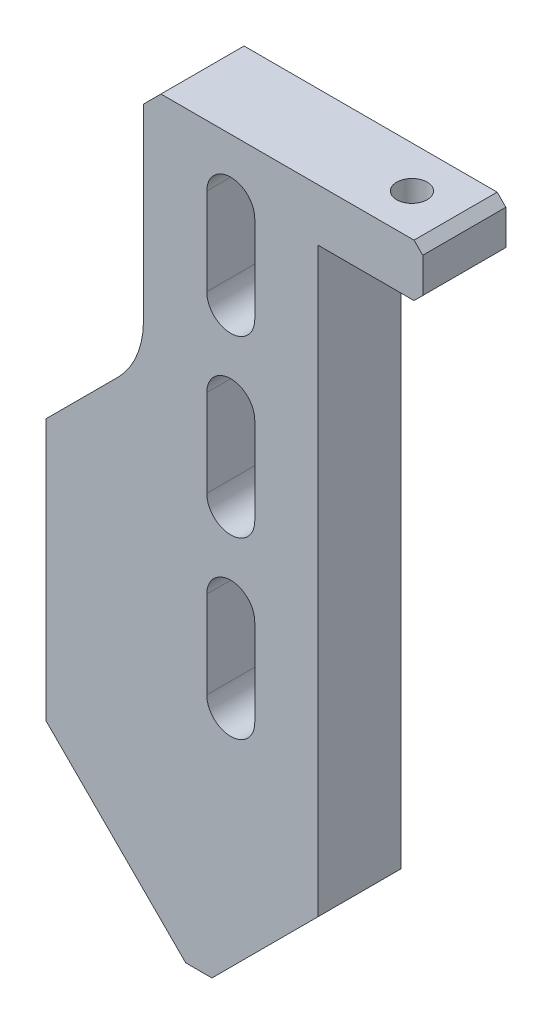
from build123d import *

# Parameters (mm, degrees)
BOSS_EXTRUDE1_DEPTH      = 4.7625
BOSS_EXTRUDE1_DEPTH_BACK = 4.7625
SKETCH2_R                = 1.75
CUT_EXTRUDE1_DEPTH       = 225.119197409
FILLET1_R                = 10
CHAMFER1_SIZE            = 2
CHAMFER2_SIZE            = 1


with BuildPart() as part:
    # Sketch1 → Boss-Extrude1 (new, two sides: drawn at the far end of the back side and taken through both)
    with BuildSketch(Plane.XY.offset(-BOSS_EXTRUDE1_DEPTH_BACK)):
        Polygon((-191.403805922, 11.396194078), (-207.403805922, 27.396194078), (-207.403805922, 57.396194078), (-196.247691321, 68.552308679), (-196.247691321, 96.192388155), (-164.247691321, 96.192388155), (-164.247691321, 90.192388155), (-176.247691321, 90.192388155), (-176.247691321, 23.552308679), (-188.403805922, 11.396194078), align=None)
        with BuildLine():
            Line((-183.497691321, 39.192388155), (-183.497691321, 49.192388155))
            ThreePointArc((-183.497691321, 49.192388155), (-186.247691321, 51.942388155), (-188.997691321, 49.192388155))
            Line((-188.997691321, 49.192388155), (-188.997691321, 39.192388155))
            ThreePointArc((-188.997691321, 39.192388155), (-186.247691321, 36.442388155), (-183.497691321, 39.192388155))
        make_face(mode=Mode.SUBTRACT)
        with BuildLine():
            Line((-183.497691321, 59.192388155), (-183.497691321, 69.192388155))
            ThreePointArc((-183.497691321, 69.192388155), (-186.247691321, 71.942388155), (-188.997691321, 69.192388155))
            Line((-188.997691321, 69.192388155), (-188.997691321, 59.192388155))
            ThreePointArc((-188.997691321, 59.192388155), (-186.247691321, 56.442388155), (-183.497691321, 59.192388155))
        make_face(mode=Mode.SUBTRACT)
        with BuildLine():
            Line((-183.497691321, 79.192388155), (-183.497691321, 89.192388155))
            ThreePointArc((-183.497691321, 89.192388155), (-186.247691321, 91.942388155), (-188.997691321, 89.192388155))
            Line((-188.997691321, 89.192388155), (-188.997691321, 79.192388155))
            ThreePointArc((-188.997691321, 79.192388155), (-186.247691321, 76.442388155), (-183.497691321, 79.192388155))
        make_face(mode=Mode.SUBTRACT)
    extrude(amount=BOSS_EXTRUDE1_DEPTH + BOSS_EXTRUDE1_DEPTH_BACK)

    # Sketch2 → Cut-Extrude1 (cut, through all)
    with BuildSketch(Plane(origin=(0, 96.192388155, 0), x_dir=(-1, 0, 0), z_dir=(0, 1, 0))):
        with Locations((170.247691321, 0)):
            Circle(SKETCH2_R)
    extrude(amount=-CUT_EXTRUDE1_DEPTH, mode=Mode.SUBTRACT)

    # Fillet1
    fillet1_edges = [part.edges().sort_by_distance(p)[0] for p in [
        (-196.247691321, 68.552308679, 0),
    ]]
    fillet(fillet1_edges, radius=FILLET1_R)

    # Chamfer1
    chamfer1_edges = [part.edges().sort_by_distance(p)[0] for p in [
        (-196.247691321, 96.192388155, 0),
    ]]
    chamfer(chamfer1_edges, length=CHAMFER1_SIZE)

    # Chamfer2
    chamfer2_edges = [part.edges().sort_by_distance(p)[0] for p in [
        (-164.247691321, 96.192388155, 0),
        (-164.247691321, 90.192388155, 0),
    ]]
    chamfer(chamfer2_edges, length=CHAMFER2_SIZE)


solid = part.part
